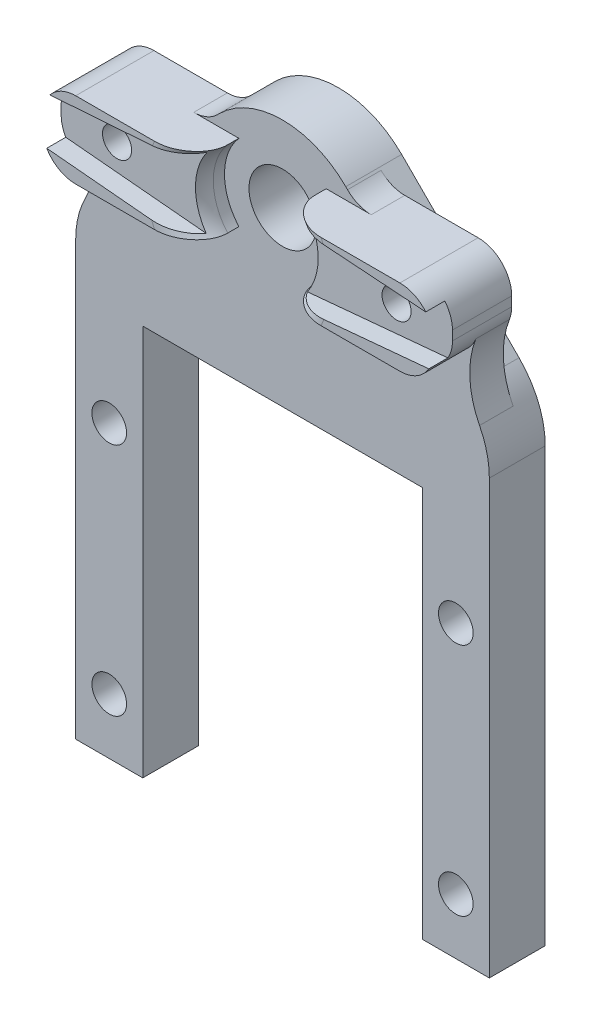
from build123d import *

# Parameters (mm, degrees)
SKETCH_1_R           = 3
SKETCH_1_R_2         = 1.55
EXTRUDE_1_DEPTH      = 5
EXTRUDE_2_DEPTH      = 4
EXTRUDE_2_DEPTH_BACK = 3
SKETCH_2_R           = 1.3
FILLET_1_R           = 8
FILLET_2_R           = 3
CUT_EXTRUDE_1_REACH  = 62.544
SKETCH_3_R           = 3.421397557
CUT_EXTRUDE_2_DEPTH  = 1.7
FILLET_START         = 2
FILLET_3_DEPTH       = 3


with BuildPart() as part:
    # 草图1 → 凸台-拉伸1 (new body)
    with BuildSketch(Plane.XY):
        Polygon((-12.5, 0), (-18.5, 0), (-18.5, 42.034916596), (0, 60.534916596), (18.5, 42.034916596), (18.5, 0), (12.5, 0), (12.5, 35), (-12.5, 35), align=None)
        with Locations((0, 50.421397557)):
            Circle(SKETCH_1_R, mode=Mode.SUBTRACT)
        with Locations((-15.5, 5)):
            Circle(SKETCH_1_R_2, mode=Mode.SUBTRACT)
        with Locations((-15.5, 26)):
            Circle(SKETCH_1_R_2, mode=Mode.SUBTRACT)
        with Locations(Location((15.5, 5, 0), (0, 0, 180))):
            Circle(SKETCH_1_R_2, mode=Mode.SUBTRACT)
        with Locations(Location((15.5, 26, 0), (0, 0, 180))):
            Circle(SKETCH_1_R_2, mode=Mode.SUBTRACT)
    extrude(amount=EXTRUDE_1_DEPTH)

    # 草图2 → 凸台-拉伸2 (add, two sides: drawn at the far end of the back side and taken through both)
    # profile 1 of 2: a face of its own
    with BuildSketch(Plane.XY.offset(5).offset(-EXTRUDE_2_DEPTH_BACK)):
        with BuildLine():
            Line((17.5, 47), (3.906515802, 47))
            ThreePointArc((3.906515802, 47), (5.192959363, 50.421397557), (3.906515802, 53.842795113))
            Line((3.906515802, 53.842795113), (17.5, 53.842795113))
            Line((17.5, 53.842795113), (17.5, 47))
        make_face()
        with Locations(Location((12.5, 50.421397557, 0), (0, 0, 180))):
            Circle(SKETCH_2_R, mode=Mode.SUBTRACT)
    # profile 2 of 2: a face of its own
    with BuildSketch(Plane.XY.offset(5).offset(-EXTRUDE_2_DEPTH_BACK)):
        with BuildLine():
            Line((-17.5, 47), (-17.5, 53.842795113))
            Line((-17.5, 53.842795113), (-3.906515802, 53.842795113))
            ThreePointArc((-3.906515802, 53.842795113), (-5.192959363, 50.421397557), (-3.906515802, 47))
            Line((-3.906515802, 47), (-17.5, 47))
        make_face()
        with Locations((-12.5, 50.421397557)):
            Circle(SKETCH_2_R, mode=Mode.SUBTRACT)
    extrude(amount=EXTRUDE_2_DEPTH + EXTRUDE_2_DEPTH_BACK)

    # 圆角1
    fillet_1_edges = [part.edges().sort_by_distance(p)[0] for p in [
        (-18.5, 42.034916596, 2.5),
        (0, 60.534916596, 2.5),
        (18.5, 42.034916596, 2.5),
    ]]
    fillet(fillet_1_edges, radius=FILLET_1_R)

    # 圆角2
    fillet_2_edges = [part.edges().sort_by_distance(p)[0] for p in [
        (-6.692121483, 53.842795113, 3.5),
        (-17.5, 47, 5.5),
        (-5.192959363, 50.421397557, 9),
        (-17.5, 53.842795113, 5.5),
        (6.692121483, 53.842795113, 3.5),
        (17.5, 53.842795113, 5.5),
        (5.192959363, 50.421397557, 9),
        (17.5, 47, 5.5),
    ]]
    fillet(fillet_2_edges, radius=FILLET_2_R)

    # 草图3 → 切除-拉伸1 (cut, up to next)
    with BuildSketch(Plane(origin=(0, 0, 2), x_dir=(-1, 0, 0), z_dir=(0, 0, -1)), mode=Mode.PRIVATE) as cut_extrude_1_sk1:
        with Locations((-12.5, 50.421397557)):
            Circle(SKETCH_3_R)
    cut_extrude_1_tool1 = extrude(cut_extrude_1_sk1.sketch, amount=CUT_EXTRUDE_1_REACH, mode=Mode.PRIVATE) & part.part
    # 草图3 → 切除-拉伸1 (cut, up to next)
    with BuildSketch(Plane(origin=(0, 0, 2), x_dir=(-1, 0, 0), z_dir=(0, 0, -1)), mode=Mode.PRIVATE) as cut_extrude_1_sk2:
        with Locations((12.5, 50.421397557)):
            Circle(SKETCH_3_R)
    cut_extrude_1_tool2 = extrude(cut_extrude_1_sk2.sketch, amount=CUT_EXTRUDE_1_REACH, mode=Mode.PRIVATE) & part.part
    add(cut_extrude_1_tool1.solids().sort_by_distance((12.5, 50.421398, 2))[0], mode=Mode.SUBTRACT)
    add(cut_extrude_1_tool2.solids().sort_by_distance((-12.5, 50.421398, 2))[0], mode=Mode.SUBTRACT)

    # 草图4 → 切除-拉伸2 (cut)
    with BuildSketch(Plane.XY.offset(9)):
        Polygon((0, 46.899022366), (43.079074711, 50.891584803), (0, 53.943772747), (-43.079074711, 50.891584803), align=None)
    extrude(amount=-CUT_EXTRUDE_2_DEPTH, mode=Mode.SUBTRACT)

    # 圆角3: read off the stored shape, not the designer's step
    # 圆角3 outline → 圆角3 (add)
    with BuildSketch(Plane.XY.offset(FILLET_START)):
        with BuildLine():
            ThreePointArc((17.623806552, 42.361452624), (16.757691875, 45.600251323), (17.294803574, 48.909553768))
            ThreePointArc((17.294803574, 48.909553768), (16.192433353, 47.52297167), (14.5, 47))
            Line((14.5, 47), (13.534916596, 47))
            Line((13.534916596, 47), (16.156854249, 44.378062347))
            ThreePointArc((16.156854249, 44.378062347), (16.969389563, 43.42726788), (17.623806552, 42.361452624))
        make_face()
        with BuildLine():
            ThreePointArc((-14.5, 47), (-16.192433353, 47.52297167), (-17.294803574, 48.909553768))
            ThreePointArc((-17.294803574, 48.909553768), (-16.757691875, 45.600251323), (-17.623806552, 42.361452624))
            ThreePointArc((-17.623806552, 42.361452624), (-16.969389563, 43.42726788), (-16.156854249, 44.378062347))
            Line((-16.156854249, 44.378062347), (-13.534916596, 47))
            Line((-13.534916596, 47), (-14.5, 47))
        make_face()
    extrude(amount=FILLET_3_DEPTH)


solid = part.part
